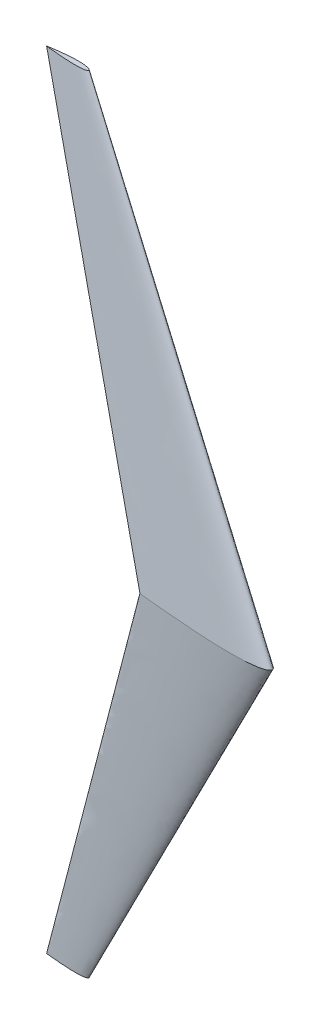
from build123d import *


with BuildPart() as part:
    # Loft1: read off the stored shape, not the designer's step
    # Loft1: loft between two sections, ruled curve by curve
    loft1_from = [
        Edge.make_bspline([(-11186.569999882, 0, 3.3e-08), (-11185.509082555, 0, 31.564284048), (-10542.211430717, 0, 73.632770684), (-9925.033440107, 0, 145.832351574), (-8927.472939235, 0, 232.597906204), (-7828.964505415, 0, 327.228255227), (-6705.978773337, 0, 413.136384276), (-5591.134432869, 0, 486.395301947), (-4476.728510788, 0, 541.121314033), (-3549.514072259, 0, 567.104684482), (-2808.867329065, 0, 570.440123359), (-2252.723152734, 0, 560.621580177), (-1695.178948212, 0, 533.468396406), (-1229.659103782, 0, 490.20119035), (-856.072290218, 0, 433.660117816), (-572.833235786, 0, 375.432777002), (-331.946298504, 0, 299.217236285), (-122.333258311, 0, 202.17254011), (68.583222039, 0, 3.390129842), (-102.047246786, 0, -213.877027246), (-302.983855266, 0, -329.926998771), (-537.906417435, 0, -427.852265838), (-817.853839122, 0, -509.863835678), (-1190.112819677, 0, -595.810122679), (-1657.72390169, 0, -670.682096343), (-2220.590351439, 0, -729.676566337), (-2783.957935501, 0, -763.640860075), (-3535.372592153, 0, -784.308351911), (-4473.650228488, 0, -768.241402928), (-5597.617950288, 0, -705.927278911), (-6717.209841904, 0, -614.25507758), (-7842.510802627, 0, -496.788057901), (-8940.333294057, 0, -360.223766124), (-9934.907670627, 0, -222.497029421), (-10547.803006358, 0, -115.507024838), (-11187.63124452, 0, -31.574022107), (-11186.569999882, 0, 3.3e-08)], [0, 0, 0, 0, 0.02485658, 0.049580772, 0.098940224, 0.148192632, 0.197348012, 0.246404635, 0.295381548, 0.344092485, 0.368447039, 0.392825531, 0.417270351, 0.441875437, 0.454314641, 0.466933942, 0.480006951, 0.48707482, 0.498208629, 0.509352394, 0.516454103, 0.529614173, 0.542350695, 0.554914414, 0.579827111, 0.604615258, 0.629351005, 0.654068345, 0.703502949, 0.752777521, 0.802109444, 0.851484926, 0.900905124, 0.950375397, 0.975135751, 1, 1, 1, 1], 3),
    ]
    loft1_to = [
        Edge.make_bspline([(-21974.796499962, 33202.771, -2904.866059928), (-21974.457907631, 33202.771, -2894.792301227), (-21769.149106464, 33202.771, -2881.366120726), (-21572.176408352, 33202.771, -2858.323583949), (-21253.804423748, 33202.771, -2830.632310344), (-20903.214850276, 33202.771, -2800.430981065), (-20544.813333616, 33202.771, -2773.013354412), (-20189.010145297, 33202.771, -2749.632730714), (-19833.346878432, 33202.771, -2732.166893386), (-19537.425877759, 33202.771, -2723.874286391), (-19301.048058215, 33202.771, -2722.809779295), (-19123.554335577, 33202.771, -2725.943372622), (-18945.613794526, 33202.771, -2734.609326386), (-18797.042880773, 33202.771, -2748.418078987), (-18677.812444082, 33202.771, -2766.463193749), (-18587.416542691, 33202.771, -2785.046482333), (-18510.537342107, 33202.771, -2809.370713055), (-18443.639222906, 33202.771, -2840.342581458), (-18382.708130242, 33202.771, -2903.784097753), (-18437.164928968, 33202.771, -2973.125032418), (-18501.293960824, 33202.771, -3010.162445082), (-18576.269628964, 33202.771, -3041.415345811), (-18665.615005419, 33202.771, -3067.589385587), (-18784.421663277, 33202.771, -3095.019188704), (-18933.659996817, 33202.771, -3118.914622948), (-19113.299135708, 33202.771, -3137.742739566), (-19293.098213533, 33202.771, -3148.58246247), (-19532.912617963, 33202.771, -3155.178504231), (-19832.36444432, 33202.771, -3150.050728328), (-20191.079363505, 33202.771, -3130.163141669), (-20548.397733933, 33202.771, -3100.905907262), (-20907.538154996, 33202.771, -3063.416243755), (-21257.908810446, 33202.771, -3019.831673266), (-21575.327773905, 33202.771, -2975.876110077), (-21770.933660797, 33202.771, -2941.730191081), (-21975.135196754, 33202.771, -2914.942926558), (-21974.796499962, 33202.771, -2904.866059928)], [0, 0, 0, 0, 0.02485658, 0.049580772, 0.098940224, 0.148192632, 0.197348012, 0.246404635, 0.295381548, 0.344092485, 0.368447039, 0.392825531, 0.417270351, 0.441875437, 0.454314641, 0.466933942, 0.480006951, 0.48707482, 0.498208629, 0.509352394, 0.516454103, 0.529614173, 0.542350695, 0.554914414, 0.579827111, 0.604615258, 0.629351005, 0.654068345, 0.703502949, 0.752777521, 0.802109444, 0.851484926, 0.900905124, 0.950375397, 0.975135751, 1, 1, 1, 1], 3),
    ]
    loft1 = Solid(Shell([*[Face.make_surface_from_curves(loft1_from[k], loft1_to[k]) for k in range(1)], Face(Wire(loft1_from)), Face(Wire(loft1_to))]))
    add(loft1)

    # Specchia1: Loft1 across plane
    add(loft1.mirror(Plane.ZX))


solid = part.part
